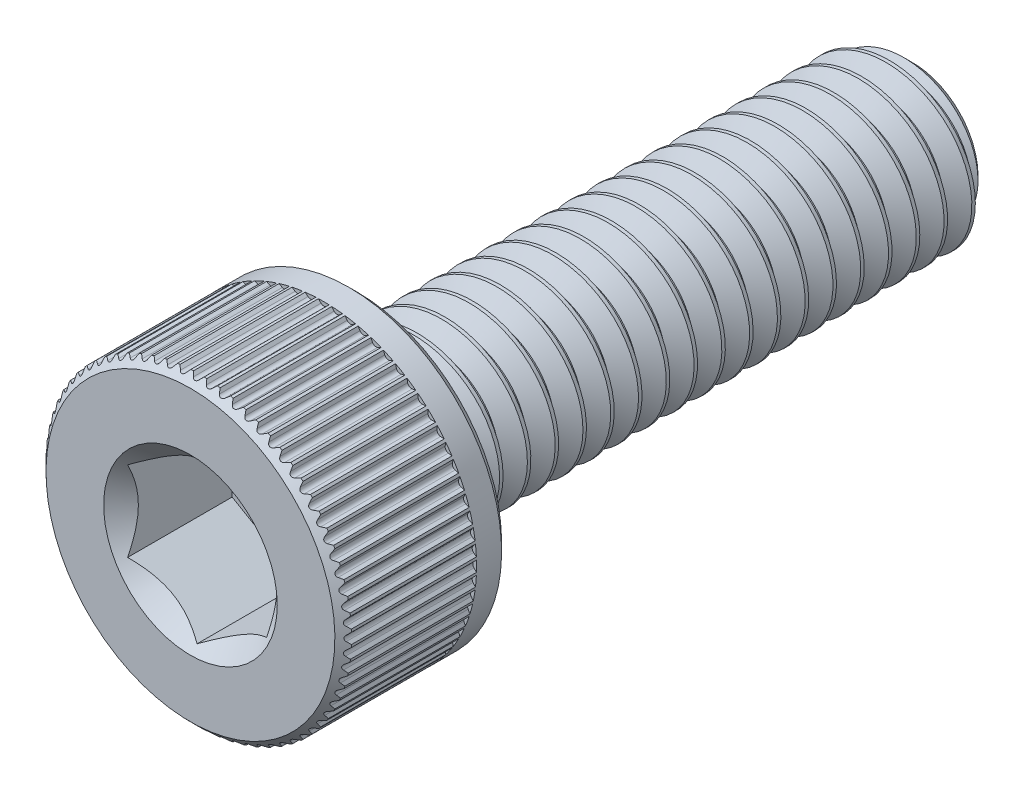
from build123d import *

# Parameters (mm, degrees)
CUT_EXTRUDE1_DEPTH     = 2
SKETCH4_R              = 1.5625
CUT_EXTRUDE2_DEPTH     = 1.5
CUT_EXTRUDE2_DRAFT     = -45
SPLIT1_SURFACE_1_BACK  = 16.149
SPLIT1_SURFACE_1_DEPTH = 32.298
SPLIT1_SURFACE_2_BACK  = 16.149
SPLIT1_SURFACE_2_DEPTH = 32.298
CUT_SWEEP1_PITCH       = 0.5
CUT_EXTRUDE3_DEPTH     = 2.4
CIRPATTERN1_COUNT      = 72


with BuildPart() as part:
    # Sketch2 → Revolve1 (revolve)
    with BuildSketch(Plane(origin=(0, 0, 0), x_dir=(0, 0, -1), z_dir=(1, 0, 0))):
        with BuildLine():
            Line((-6.5, 0), (-6.5, 2.6))
            Line((-6.5, 2.6), (-6.35, 2.75))
            Line((-6.35, 2.75), (-3.65, 2.75))
            Line((-3.65, 2.75), (-3.5, 2.6))
            Line((-3.5, 2.6), (-3.5, 1.65))
            ThreePointArc((-3.5, 1.65), (-3.456066017, 1.543933983), (-3.35, 1.5))
            Line((-3.35, 1.5), (6.175240474, 1.5))
            Line((6.175240474, 1.5), (6.5, 1.175240474))
            Line((6.5, 1.175240474), (6.5, 0))
            Line((6.5, 0), (-6.5, 0))
        make_face()
    revolve(axis=Axis((0, 0, -6.5), (0, 0, 1)))

    # Sketch3 → Cut-Extrude1 (cut)
    with BuildSketch(Plane.XY.offset(6.5)):
        Polygon((1.25, -0.721687836), (1.25, 0.721687836), (0, 1.443375673), (-1.25, 0.721687836), (-1.25, -0.721687836), (0, -1.443375673), align=None)
    extrude(amount=-CUT_EXTRUDE1_DEPTH, mode=Mode.SUBTRACT)


with BuildPart() as cut_extrude2_tool:
    # Sketch4 → Cut-Extrude2 (with draft: the straight prism first)
    with BuildSketch(Plane.XY.offset(6.5)):
        Circle(SKETCH4_R)
    extrude(amount=-CUT_EXTRUDE2_DEPTH)
    # Cut-Extrude2: the draft: its side faces are tilted about the plane it starts from
    cut_extrude2_sides = [cut_extrude2_tool.faces().sort_by_distance(p)[0] for p in [
        (-1.5625, 0, 5.75),
    ]]
    draft(cut_extrude2_sides, Plane.XY.offset(6.5), CUT_EXTRUDE2_DRAFT)


with BuildPart() as part_1:
    add(part.part)

    # Cut-Extrude2: cut by cut_extrude2_tool
    add(cut_extrude2_tool.part, mode=Mode.SUBTRACT)


with BuildPart() as body_2:
    # Split1: the piece behind the surface
    add(part_1.part)
    # Split1 surface: a surface, the sketch's curves swept straight by 32.298 mm
    with BuildLine(Plane(origin=(0, 0, 0), x_dir=(0, 0, -1), z_dir=(1, 0, 0)).offset(-SPLIT1_SURFACE_1_BACK), mode=Mode.PRIVATE) as split1_surface_1_path:
        Line((-3.35, -2.75), (-3.35, 2.75))
    split1_surface_1 = Shell.extrude(split1_surface_1_path.wire(), (1 * SPLIT1_SURFACE_1_DEPTH, 0 * SPLIT1_SURFACE_1_DEPTH, 0 * SPLIT1_SURFACE_1_DEPTH))
    split(bisect_by=split1_surface_1, keep=Keep.BOTTOM)

    # Cut-Sweep1: the profile of Sketch7 screwed along a right-hand helix of 21 turns, 6 arcs to a turn; built about Z, then put on its axis
    cut_sweep1_z = Axis((0, 0, 0), (0, 0, 1))
    cut_sweep1_corners = [(1.527063294, 0, 0.015625), (1.527063294, 0, -0.453125), (1.175240474, 0, -0.25), (1.175240474, 0, -0.1875)]
    with BuildLine(mode=Mode.PRIVATE) as cut_sweep1_profile:
        Line(cut_sweep1_corners[0], cut_sweep1_corners[1])
        Line(cut_sweep1_corners[1], cut_sweep1_corners[2])
        Line(cut_sweep1_corners[2], cut_sweep1_corners[3])
        Line(cut_sweep1_corners[3], cut_sweep1_corners[0])
    cut_sweep1_cap = Face(cut_sweep1_profile.wire())
    cut_sweep1_turn_angles = [0, 30, 60, 90, 120, 150, 180, 210, 240, 270, 300, 330, 360]
    cut_sweep1_turn_weights = [1, 0.8660254037844387, 1, 0.8660254037844387, 1, 0.8660254037844387, 1, 0.8660254037844387, 1, 0.8660254037844387, 1, 0.8660254037844387, 1]
    cut_sweep1_turn_rails = [Edge.make_bspline([Vector(p[0], p[1], 0).rotate(cut_sweep1_z, cut_sweep1_turn_angles[k]) / cut_sweep1_turn_weights[k] + Vector(0, 0, p[2] + CUT_SWEEP1_PITCH * cut_sweep1_turn_angles[k] / 360) for k in range(13)], [0, 0, 0, 1, 1, 2, 2, 3, 3, 4, 4, 5, 5, 6, 6, 6], 2, cut_sweep1_turn_weights) for p in cut_sweep1_corners]
    cut_sweep1_turn_sides = [Face.make_surface_from_curves(cut_sweep1_turn_rails[p[0]], cut_sweep1_turn_rails[p[1]]) for p in [(0, 1), (1, 2), (2, 3), (3, 0)]]
    cut_sweep1 = Plane(origin=(0, 0, -6.5), x_dir=(0, 1, 0), z_dir=(0, 0, 1)) * Solid(Shell([*[p.moved(Location((0, 0, CUT_SWEEP1_PITCH * i))) for i in range(21) for p in cut_sweep1_turn_sides], cut_sweep1_cap, cut_sweep1_cap.rotate(cut_sweep1_z, 7560).moved(Location((0, 0, CUT_SWEEP1_PITCH * 7560 / 360)))]))
    add(cut_sweep1, mode=Mode.SUBTRACT)


with BuildPart() as part_2:
    add(part_1.part)

    # Split1: split by a surface, the side it looks to stays
    # Split1 surface: a surface, the sketch's curves swept straight by 32.298 mm
    with BuildLine(Plane(origin=(0, 0, 0), x_dir=(0, 0, -1), z_dir=(1, 0, 0)).offset(-SPLIT1_SURFACE_2_BACK), mode=Mode.PRIVATE) as split1_surface_2_path:
        Line((-3.35, -2.75), (-3.35, 2.75))
    split1_surface_2 = Shell.extrude(split1_surface_2_path.wire(), (1 * SPLIT1_SURFACE_2_DEPTH, 0 * SPLIT1_SURFACE_2_DEPTH, 0 * SPLIT1_SURFACE_2_DEPTH))
    split(bisect_by=split1_surface_2, keep=Keep.TOP)

    add(body_2.part)  # Revolve2 merges body 2
    # Sketch8 → Revolve2 (revolve)
    with BuildSketch(Plane(origin=(0, 0, 0), x_dir=(0, 0, -1), z_dir=(1, 0, 0))):
        Polygon((-3.5, 0), (-3.5, 1.5), (-3.35, 1.5), (-2.483974596, 0), align=None)
    revolve(axis=Axis((0, 0, 2.483974596), (0, 0, 1)))

    # Sketch12 → Cut-Extrude3 (cut)
    with BuildSketch(Plane.XY.offset(6.5)):
        with BuildLine():
            Line((-0.166398842, 2.81875), (0.166398842, 2.81875))
            Line((0.166398842, 2.81875), (0.049333409, 2.701684567))
            ThreePointArc((0.049333409, 2.701684567), (0, 2.68125), (-0.049333409, 2.701684567))
            Line((-0.049333409, 2.701684567), (-0.166398842, 2.81875))
        make_face()
    cut_extrude3 = extrude(amount=-CUT_EXTRUDE3_DEPTH, mode=Mode.SUBTRACT)

    # CirPattern1: Cut-Extrude3 ×72 about axis
    cirpattern1_axis = Axis((0, 0, 0), (0, 0, 1))
    for i in range(1, CIRPATTERN1_COUNT):
        add(cut_extrude3.rotate(cirpattern1_axis, i * 360 / CIRPATTERN1_COUNT), mode=Mode.SUBTRACT)


solid = part_2.part
